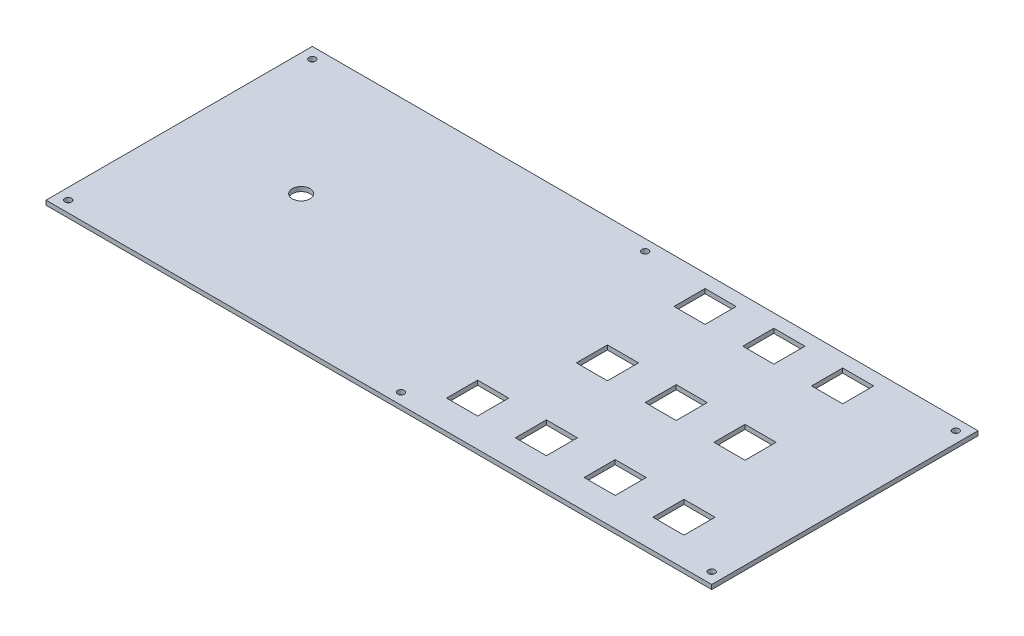
from build123d import *

# Parameters (mm, degrees)
SKETCH1_W           = 300
SKETCH1_H           = 120
SKETCH1_R           = 4
SKETCH1_R_2         = 1.5
SKETCH1_W_2         = 14
SKETCH1_H_2         = 14
BOSS_EXTRUDE1_DEPTH = 2


with BuildPart() as part:
    # Sketch1 → Boss-Extrude1 (new body)
    with BuildSketch(Plane(origin=(0, 0, 0), x_dir=(1, 0, 0), z_dir=(0, 1, 0))):
        Rectangle(SKETCH1_W, SKETCH1_H)
        with Locations((-95, 0)):
            Circle(SKETCH1_R, mode=Mode.SUBTRACT)
        with Locations((-145, 55)):
            Circle(SKETCH1_R_2, mode=Mode.SUBTRACT)
        with Locations((145, 55)):
            Circle(SKETCH1_R_2, mode=Mode.SUBTRACT)
        with Locations((-145, -55)):
            Circle(SKETCH1_R_2, mode=Mode.SUBTRACT)
        with Locations((145, -55)):
            Circle(SKETCH1_R_2, mode=Mode.SUBTRACT)
        with Locations((5, 55)):
            Circle(SKETCH1_R_2, mode=Mode.SUBTRACT)
        with Locations((5, -55)):
            Circle(SKETCH1_R_2, mode=Mode.SUBTRACT)
        with Locations((24.5, -40)):
            Rectangle(SKETCH1_W_2, SKETCH1_H_2, mode=Mode.SUBTRACT)
        with Locations((40, 3)):
            Rectangle(SKETCH1_W_2, SKETCH1_H_2, mode=Mode.SUBTRACT)
        with Locations((71, 3)):
            Rectangle(SKETCH1_W_2, SKETCH1_H_2, mode=Mode.SUBTRACT)
        with Locations((102, 3)):
            Rectangle(SKETCH1_W_2, SKETCH1_H_2, mode=Mode.SUBTRACT)
        with Locations((55.5, -40)):
            Rectangle(SKETCH1_W_2, SKETCH1_H_2, mode=Mode.SUBTRACT)
        with Locations((86.5, -40)):
            Rectangle(SKETCH1_W_2, SKETCH1_H_2, mode=Mode.SUBTRACT)
        with Locations((117.5, -40)):
            Rectangle(SKETCH1_W_2, SKETCH1_H_2, mode=Mode.SUBTRACT)
        with Locations((40, 47)):
            Rectangle(SKETCH1_W_2, SKETCH1_H_2, mode=Mode.SUBTRACT)
        with Locations((71, 47)):
            Rectangle(SKETCH1_W_2, SKETCH1_H_2, mode=Mode.SUBTRACT)
        with Locations((102, 47)):
            Rectangle(SKETCH1_W_2, SKETCH1_H_2, mode=Mode.SUBTRACT)
    extrude(amount=BOSS_EXTRUDE1_DEPTH)


solid = part.part
